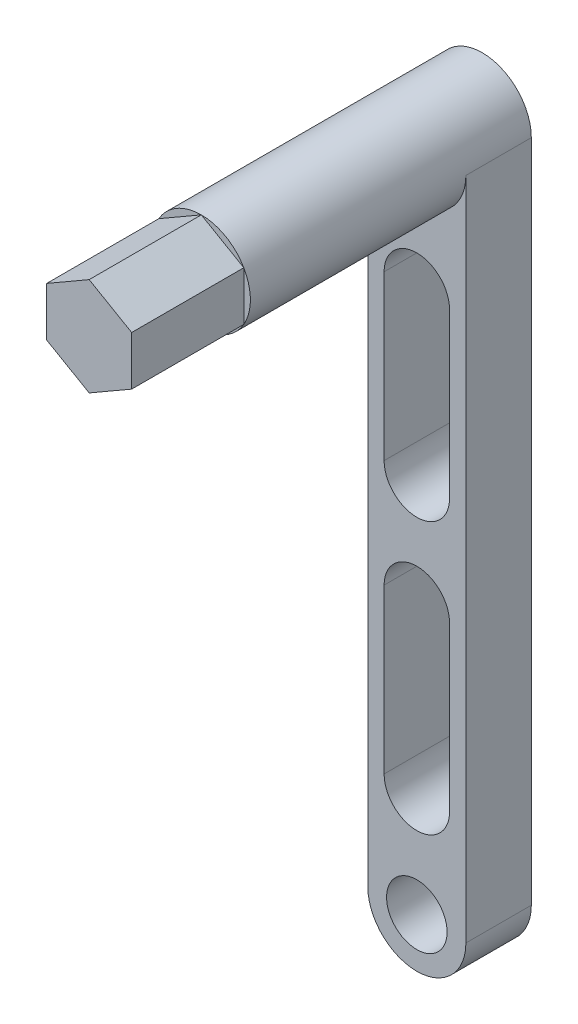
from build123d import *

# Parameters (mm, degrees)
SKETCH1_R           = 4.625
BOSS_EXTRUDE1_DEPTH = 10
BOSS_EXTRUDE2_DEPTH = 42.94
BOSS_EXTRUDE3_DEPTH = 17.14


with BuildPart() as part:
    # Sketch1 → Boss-Extrude1 (new body)
    with BuildSketch(Plane.XY):
        with BuildLine():
            Line((-7.5, 50.8), (-7.5, -50.8))
            ThreePointArc((-7.5, -50.8), (0, -58.3), (7.5, -50.8))
            Line((7.5, -50.8), (7.5, 50.8))
            ThreePointArc((7.5, 50.8), (0, 43.3), (-7.5, 50.8))
        make_face()
        with Locations((0, -50.8)):
            Circle(SKETCH1_R, mode=Mode.SUBTRACT)
        with BuildLine():
            ThreePointArc((5, -34.675), (0, -39.675), (-5, -34.675))
            Line((-5, -34.675), (-5, -9.675))
            ThreePointArc((-5, -9.675), (0, -4.675), (5, -9.675))
            Line((5, -9.675), (5, -34.675))
        make_face(mode=Mode.SUBTRACT)
        with BuildLine():
            ThreePointArc((-5, 31.8), (0, 36.8), (5, 31.8))
            Line((5, 31.8), (5, 6.8))
            ThreePointArc((5, 6.8), (0, 1.8), (-5, 6.8))
            Line((-5, 6.8), (-5, 31.8))
        make_face(mode=Mode.SUBTRACT)
    extrude(amount=BOSS_EXTRUDE1_DEPTH)

    # Sketch1<4> → Boss-Extrude2 (add)
    with BuildSketch(Plane.XY):
        with BuildLine():
            ThreePointArc((7.5, 50.8), (0, 58.3), (-7.5, 50.8))
            ThreePointArc((-7.5, 50.8), (0, 43.3), (7.5, 50.8))
        make_face()
    extrude(amount=BOSS_EXTRUDE2_DEPTH)

    # Sketch3 → Boss-Extrude3 (add)
    with BuildSketch(Plane.XY.offset(42.94)):
        Polygon((0, 43.3), (6.495190528, 47.05), (6.495190528, 54.55), (0, 58.3), (-6.495190528, 54.55), (-6.495190528, 47.05), align=None)
    extrude(amount=BOSS_EXTRUDE3_DEPTH)


solid = part.part
